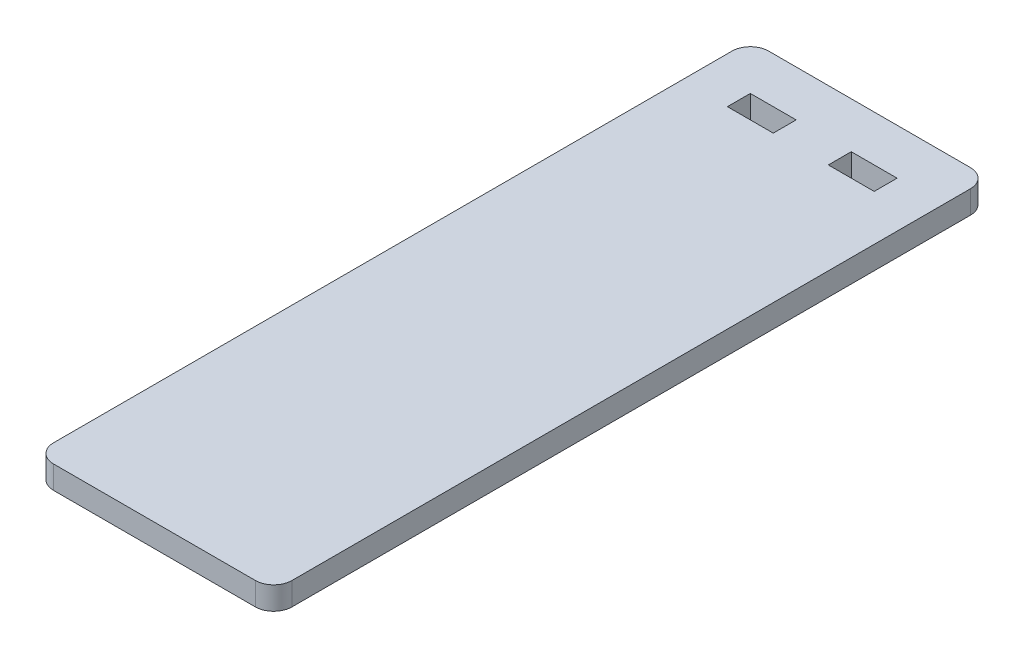
from build123d import *

# Parameters (mm, degrees)
SKETCH1_W           = 33.03
SKETCH1_H           = 99.05
BOSS_EXTRUDE1_DEPTH = 3.175
SKETCH2_W           = 6.35
SKETCH2_H           = 3.175
CUT_EXTRUDE1_DEPTH  = 63.137257853
FILLET1_R           = 2.54


with BuildPart() as part:
    # Sketch1 → Boss-Extrude1 (new body)
    with BuildSketch(Plane(origin=(0, 0, 0), x_dir=(1, 0, 0), z_dir=(0, 1, 0))):
        with Locations((-9.766081081, 6.691216216)):
            Rectangle(SKETCH1_W, SKETCH1_H)
    extrude(amount=BOSS_EXTRUDE1_DEPTH)

    # Sketch2 → Cut-Extrude1 (cut, through all)
    with BuildSketch(Plane(origin=(0, 3.175, 0), x_dir=(1, 0, 0), z_dir=(0, 1, 0))):
        with Locations((-2.776081081, 48.278716216)):
            Rectangle(SKETCH2_W, SKETCH2_H)
        with Locations((-16.756081081, 48.278716216)):
            Rectangle(SKETCH2_W, SKETCH2_H)
    extrude(amount=-CUT_EXTRUDE1_DEPTH, mode=Mode.SUBTRACT)

    # Fillet1
    fillet1_edges = [part.edges().sort_by_distance(p)[0] for p in [
        (-26.281081081, 1.5875, -56.216216216),
        (6.748918919, 1.5875, -56.216216216),
        (6.748918919, 1.5875, 42.833783784),
        (-26.281081081, 1.5875, 42.833783784),
    ]]
    fillet(fillet1_edges, radius=FILLET1_R)


solid = part.part
